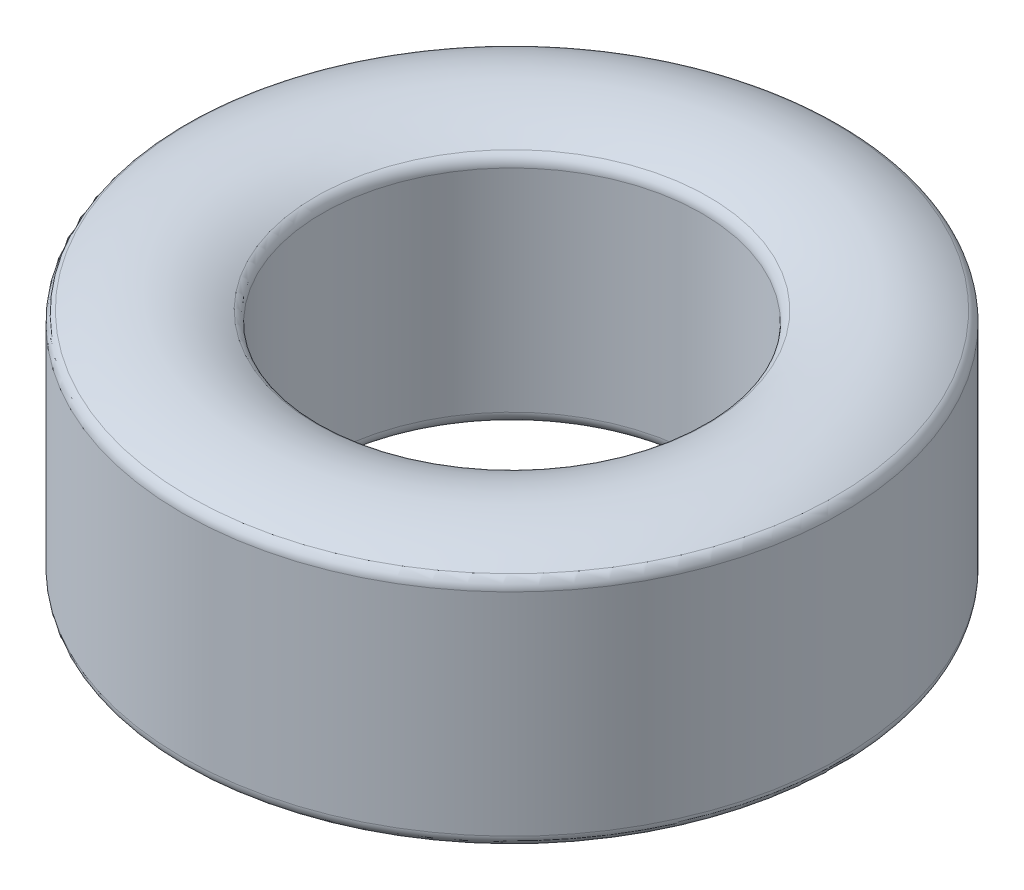
from build123d import *


with BuildPart() as part:
    # Sketch1 → Revolve1 (revolve)
    with BuildSketch(Plane(origin=(0, 0, 0), x_dir=(0, 0, -1), z_dir=(1, 0, 0))):
        with BuildLine():
            Line((-7.5, 4.177906174), (-7.5, -4.177906174))
            ThreePointArc((-7.5, -4.177906174), (-7.570496002, -4.433887259), (-7.762105263, -4.617685771))
            ThreePointArc((-7.762105263, -4.617685771), (-10.26, -5.25), (-12.757894737, -4.617685771))
            ThreePointArc((-12.757894737, -4.617685771), (-12.949503998, -4.433887259), (-13.02, -4.177906174))
            Line((-13.02, -4.177906174), (-13.02, 4.177906174))
            ThreePointArc((-13.02, 4.177906174), (-12.949503998, 4.433887259), (-12.757894737, 4.617685771))
            ThreePointArc((-12.757894737, 4.617685771), (-10.26, 5.25), (-7.762105263, 4.617685771))
            ThreePointArc((-7.762105263, 4.617685771), (-7.570496002, 4.433887259), (-7.5, 4.177906174))
        make_face()
    revolve(axis=Axis((0, 59.122190237, 0), (0, -1, 0)))


solid = part.part
